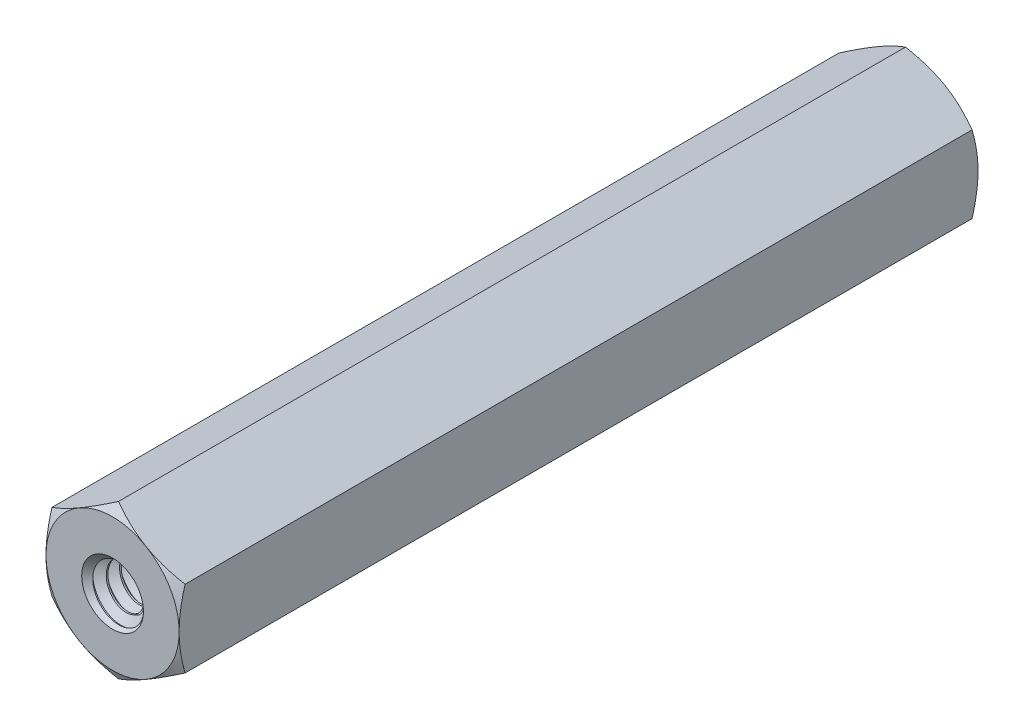
from build123d import *

# Parameters (mm, degrees)
EXTRUDE1_DEPTH          = 19.05
EXTRUDE1_DEPTH_BACK     = 19.05
SKETCH1_R               = 1.4224
SWEEP1_PITCH            = 0.635
EXTRUDE2_DEPTH          = 40.037611488
SKETCH8_OUTSIDE_W       = 155.03
SKETCH8_OUTSIDE_H       = 156.012
SKETCH8_OUTSIDE_R       = 3.175
EXTRUDE4_DEPTH          = 40.037611488
EXTRUDE4_DRAFT          = -60
MIRROR1_COPY_1_SKETCH_W = 155.03
MIRROR1_COPY_1_SKETCH_H = 156.012
MIRROR1_COPY_1_SKETCH_R = 3.175
MIRROR1_COPY_1_DEPTH    = 40.037611488
MIRROR1_COPY_1_DRAFT    = -60
SKETCH9_W               = 25.4
SKETCH9_H               = 1.4732


with BuildPart() as part:
    # Sketch1 → Extrude1 (new, two sides: drawn at the far end of the back side and taken through both)
    with BuildSketch(Plane.XY.offset(-EXTRUDE1_DEPTH_BACK)):
        Polygon((0, 3.666174209), (-3.175, 1.833087105), (-3.175, -1.833087105), (0, -3.666174209), (3.175, -1.833087105), (3.175, 1.833087105), align=None)
        with Locations(Location((0, 0, 0), (0, 0, 180))):
            Circle(SKETCH1_R, mode=Mode.SUBTRACT)
    extrude(amount=EXTRUDE1_DEPTH + EXTRUDE1_DEPTH_BACK)

    # Sweep1: the profile of Sketch12 profile screwed along a right-hand helix of 61 turns, 6 arcs to a turn; built about Z, then put on its axis
    sweep1_z = Axis((0, 0, 0), (0, 0, 1))
    sweep1_corners = [(1.4227, 0, -0.555798205), (1.4227, 0, 0.000173205), (1.009955401, 0, -0.238125), (1.009955401, 0, -0.3175)]
    with BuildLine(mode=Mode.PRIVATE) as sweep1_profile:
        Line(sweep1_corners[0], sweep1_corners[1])
        Line(sweep1_corners[1], sweep1_corners[2])
        Line(sweep1_corners[2], sweep1_corners[3])
        Line(sweep1_corners[3], sweep1_corners[0])
    sweep1_cap = Face(sweep1_profile.wire())
    sweep1_turn_angles = [0, 30, 60, 90, 120, 150, 180, 210, 240, 270, 300, 330, 360, 390, 420, 450, 480, 510, 540, 570, 600, 630, 660, 690, 720]
    sweep1_turn_weights = [1, 0.8660254037844387, 1, 0.8660254037844387, 1, 0.8660254037844387, 1, 0.8660254037844387, 1, 0.8660254037844387, 1, 0.8660254037844387, 1, 0.8660254037844387, 1, 0.8660254037844387, 1, 0.8660254037844387, 1, 0.8660254037844387, 1, 0.8660254037844387, 1, 0.8660254037844387, 1]
    sweep1_turn_rails = [Edge.make_bspline([Vector(p[0], p[1], 0).rotate(sweep1_z, sweep1_turn_angles[k]) / sweep1_turn_weights[k] + Vector(0, 0, p[2] + SWEEP1_PITCH * sweep1_turn_angles[k] / 360) for k in range(25)], [0, 0, 0, 1, 1, 2, 2, 3, 3, 4, 4, 5, 5, 6, 6, 7, 7, 8, 8, 9, 9, 10, 10, 11, 11, 12, 12, 12], 2, sweep1_turn_weights) for p in sweep1_corners]
    sweep1_turn_sides = [Face.make_surface_from_curves(sweep1_turn_rails[p[0]], sweep1_turn_rails[p[1]]) for p in [(0, 1), (1, 2), (2, 3), (3, 0)]]
    sweep1_last_angles = [21600, 21630, 21660, 21690, 21720, 21750, 21780, 21810, 21840, 21870, 21900, 21930, 21960]
    sweep1_last_weights = [1, 0.8660254037844387, 1, 0.8660254037844387, 1, 0.8660254037844387, 1, 0.8660254037844387, 1, 0.8660254037844387, 1, 0.8660254037853276, 1]
    sweep1_last_rails = [Edge.make_bspline([Vector(p[0], p[1], 0).rotate(sweep1_z, sweep1_last_angles[k]) / sweep1_last_weights[k] + Vector(0, 0, p[2] + SWEEP1_PITCH * sweep1_last_angles[k] / 360) for k in range(13)], [0, 0, 0, 1, 1, 2, 2, 3, 3, 4, 4, 5, 5, 6, 6, 6], 2, sweep1_last_weights) for p in sweep1_corners]
    sweep1_last_sides = [Face.make_surface_from_curves(sweep1_last_rails[p[0]], sweep1_last_rails[p[1]]) for p in [(0, 1), (1, 2), (2, 3), (3, 0)]]
    sweep1 = Plane(origin=(0, 0, -19.05), x_dir=(0, 1, 0), z_dir=(0, 0, 1)) * Solid(Shell([*[p.moved(Location((0, 0, 2 * SWEEP1_PITCH * i))) for i in range(30) for p in sweep1_turn_sides], *sweep1_last_sides, sweep1_cap, sweep1_cap.rotate(sweep1_z, 21960).moved(Location((0, 0, SWEEP1_PITCH * 21960 / 360)))]))
    add(sweep1)

    # Sketch6 → Extrude2 (cut, through all)
    with BuildSketch(Plane(origin=(0, 0, -19.05), x_dir=(-1, 0, 0), z_dir=(0, 0, -1))):
        Polygon((0, 3.666174209), (-3.175, 1.833087105), (-3.175, -1.833087105), (0, -3.666174209), (3.175, -1.833087105), (3.175, 1.833087105), align=None)
    extrude2 = extrude(amount=EXTRUDE2_DEPTH, mode=Mode.SUBTRACT)

    # Extrude3 cone 1 section (through the dimple's axis) → Extrude3 (revolve, cut)
    with BuildSketch(Plane(origin=(0, 0, -19.05), x_dir=(0, 1, 0), z_dir=(1, 0, 0))):
        Polygon((0, 0), (1.4732, 0), (0, 1.579813584), align=None)
    extrude3 = revolve(axis=Axis((0, 0, -19.05), (0, 0, 1)), mode=Mode.SUBTRACT)


with BuildPart() as extrude4_tool:
    # Sketch8 outside → Extrude4 (with draft: the straight prism first)
    with BuildSketch(Plane(origin=(0, 0, -19.05), x_dir=(-1, 0, 0), z_dir=(0, 0, -1))):
        Rectangle(SKETCH8_OUTSIDE_W, SKETCH8_OUTSIDE_H)
        Circle(SKETCH8_OUTSIDE_R, mode=Mode.SUBTRACT)
    extrude(amount=-EXTRUDE4_DEPTH)
    # Extrude4: the draft: its side faces are tilted about the plane it starts from
    extrude4_sides = [extrude4_tool.faces().sort_by_distance(p)[0] for p in [
        (0, -78.006, 0.968805744),
        (-77.515, 0, 0.968805744),
        (0, 78.006, 0.968805744),
        (77.515, 0, 0.968805744),
        (3.175, 0, 0.968805744),
    ]]
    draft(extrude4_sides, Plane(origin=(0, 0, -19.05), x_dir=(-1, 0, 0), z_dir=(0, 0, -1)), EXTRUDE4_DRAFT)


with BuildPart() as part_1:
    add(part.part)

    # Extrude4: cut by extrude4_tool
    add(extrude4_tool.part, mode=Mode.SUBTRACT)

    # Mirror1: Extrude2, Extrude3 across plane
    add(extrude2.mirror(Plane.XY), mode=Mode.SUBTRACT)
    add(extrude3.mirror(Plane.XY), mode=Mode.SUBTRACT)


with BuildPart() as mirror1_copy_1_tool:
    # Mirror1 copy 1 sketch → Mirror1 copy 1 (with draft: the straight prism first)
    with BuildSketch(Plane(origin=(0, 0, 19.05), x_dir=(-1, 0, 0), z_dir=(0, 0, 1))):
        Rectangle(MIRROR1_COPY_1_SKETCH_W, MIRROR1_COPY_1_SKETCH_H)
        Circle(MIRROR1_COPY_1_SKETCH_R, mode=Mode.SUBTRACT)
    extrude(amount=-MIRROR1_COPY_1_DEPTH)
    # Mirror1 copy 1: the draft: its side faces are tilted about the plane it starts from
    mirror1_copy_1_sides = [mirror1_copy_1_tool.faces().sort_by_distance(p)[0] for p in [
        (0, -78.006, -0.968805744),
        (-77.515, 0, -0.968805744),
        (0, 78.006, -0.968805744),
        (77.515, 0, -0.968805744),
        (3.175, 0, -0.968805744),
    ]]
    draft(mirror1_copy_1_sides, Plane(origin=(0, 0, 19.05), x_dir=(-1, 0, 0), z_dir=(0, 0, 1)), MIRROR1_COPY_1_DRAFT)


with BuildPart() as part_2:
    add(part_1.part)

    # Mirror1 copy 1: cut by mirror1_copy_1_tool
    add(mirror1_copy_1_tool.part, mode=Mode.SUBTRACT)

    # Sketch9 → Revolve 2 (revolve)
    with BuildSketch(Plane(origin=(0, 0, 0), x_dir=(0, 0, -1), z_dir=(1, 0, 0)), mode=Mode.PRIVATE) as revolve_2_sk:
        with Locations((0, 0.7366)):
            Rectangle(SKETCH9_W, SKETCH9_H)
    revolve(revolve_2_sk.sketch.rotate(Axis((0, 0, 19.05), (0, 0, -1)), 270), axis=Axis((0, 0, 19.05), (0, 0, -1)))


solid = part_2.part
